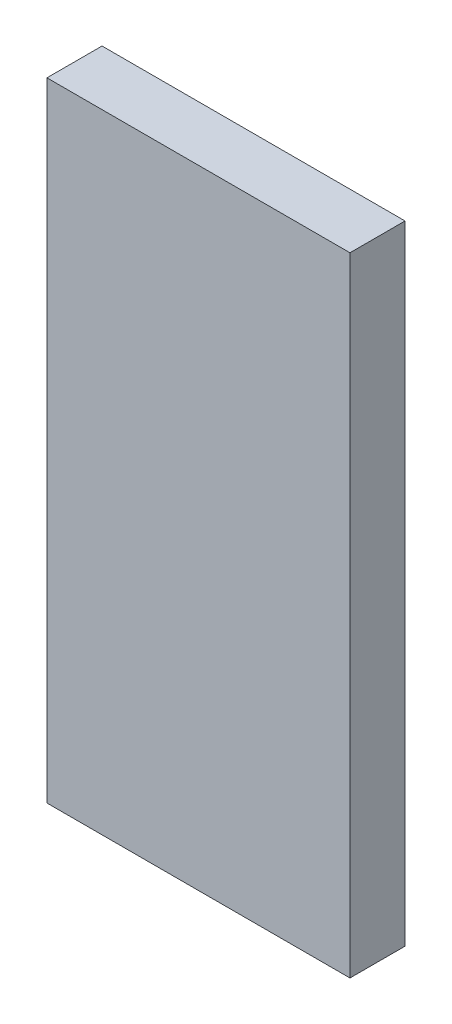
from build123d import *

# Parameters (mm, degrees)
SKETCH1_W                       = 39
SKETCH1_H                       = 155
BOSS_EXTRUDE1_DEPTH             = 2
BOSS_EXTRUDE2_DEPTH             = 38
SKETCH3_W                       = 2
SKETCH3_H                       = 2
BOSS_EXTRUDE3_DEPTH             = 38
SKETCH4_W                       = 2
SKETCH4_H                       = 2
BOSS_EXTRUDE4_DEPTH             = 151
SKETCH6_W                       = 35
SKETCH6_H                       = 2.2
CUT_EXTRUDE1_DEPTH              = 160.340045186
SKETCH7_W                       = 35
SKETCH7_H                       = 2.2
CUT_EXTRUDE2_DEPTH              = 89.490112442
SKETCH5_W                       = 31
SKETCH5_H                       = 2
BOSS_EXTRUDE5_DEPTH             = 2
BOSS_EXTRUDE6_REACH             = 91.367
SKETCH8_W                       = 2
SKETCH8_H                       = 2
BOSS_EXTRUDE6_DIRECTION_2_REACH = 91.367
SKETCH10_W                      = 2
SKETCH10_H                      = 2.2
SKETCH10_W_2                    = 2.2
SKETCH10_H_2                    = 2
BOSS_EXTRUDE8_DEPTH             = 2
SKETCH11_W                      = 2
SKETCH11_H                      = 2.2
SKETCH11_W_2                    = 2.2
SKETCH11_H_2                    = 2
BOSS_EXTRUDE9_DEPTH             = 2
FILLET2_R                       = 2.5
SKETCH14_W                      = 36.5
SKETCH14_H                      = 7.75
BOSS_EXTRUDE10_DEPTH            = 2
SKETCH13_W                      = 31
SKETCH13_H                      = 3
CUT_EXTRUDE4_DEPTH              = 2
FILLET3_R                       = 2
FILLET4_R                       = 0.5
SKETCH15_R                      = 5.1
CUT_EXTRUDE5_DEPTH              = 90.367219941
SKETCH16_R                      = 7.1
BOSS_EXTRUDE11_DEPTH            = 1
FILLET5_R                       = 0.5
FILLET7_R                       = 0.5
CUT_EXTRUDE6_DEPTH              = 6
SKETCH18_W                      = 29
SKETCH18_H                      = 3
CUT_EXTRUDE8_DEPTH              = 90.367219986
CUT_EXTRUDE11_DEPTH             = 90.367219986
CUT_EXTRUDE11_DEPTH_BACK        = 90.367219986
SKETCH20_W                      = 5
SKETCH20_H                      = 40
SKETCH21_W                      = 9
SKETCH21_H                      = 31
CUT_EXTRUDE12_DEPTH             = 89.41097217
CUT_EXTRUDE13_DEPTH             = 41.425858061
CUT_EXTRUDE13_DEPTH_BACK        = 41.425858061
SKETCH22_W                      = 11
SKETCH22_H                      = 8.2


with BuildPart() as part:
    # Sketch1 → Boss-Extrude1 (new body)
    with BuildSketch(Plane(origin=(0, 0, 0), x_dir=(1, 0, 0), z_dir=(0, 1, 0))):
        Rectangle(SKETCH1_W, SKETCH1_H)
    extrude(amount=BOSS_EXTRUDE1_DEPTH)

    # Sketch2 → Boss-Extrude2 (add)
    with BuildSketch(Plane(origin=(0, 2, 0), x_dir=(1, 0, 0), z_dir=(0, 1, 0))):
        Polygon((-17.5, -77.5), (-17.5, -75.5), (-17.5, 75.5), (17.5, 75.5), (17.5, -75.5), (17.5, -77.5), (19.5, -77.5), (19.5, 77.5), (-19.5, 77.5), (-19.5, -77.5), align=None)
    extrude(amount=BOSS_EXTRUDE2_DEPTH)

    # Sketch3 → Boss-Extrude3 (add)
    with BuildSketch(Plane(origin=(0, 2, 0), x_dir=(1, 0, 0), z_dir=(0, 1, 0))):
        with Locations((-16.5, -76.5)):
            Rectangle(SKETCH3_W, SKETCH3_H)
        with Locations((-16.5, -72.3)):
            Rectangle(SKETCH3_W, SKETCH3_H)
        with Locations((16.5, -76.5)):
            Rectangle(SKETCH3_W, SKETCH3_H)
        with Locations((16.5, -72.3)):
            Rectangle(SKETCH3_W, SKETCH3_H)
    extrude(amount=BOSS_EXTRUDE3_DEPTH)

    # Sketch4 → Boss-Extrude4 (add)
    with BuildSketch(Plane.XY.offset(-75.5)):
        with Locations((-16.5, 39)):
            Rectangle(SKETCH4_W, SKETCH4_H)
        Polygon((-15.5, 33.8), (-17.5, 31.8), (-17.5, 35.8), (-15.5, 35.8), align=None)
        Polygon((15.5, 35.8), (17.5, 35.8), (17.5, 31.8), (15.5, 33.8), align=None)
        with Locations((16.5, 39)):
            Rectangle(SKETCH4_W, SKETCH4_H)
    extrude(amount=BOSS_EXTRUDE4_DEPTH)

    # Sketch6 → Cut-Extrude1 (cut, through all)
    with BuildSketch(Plane.XY.offset(-75.5)):
        with Locations((0, 36.9)):
            Rectangle(SKETCH6_W, SKETCH6_H)
    extrude(amount=CUT_EXTRUDE1_DEPTH, mode=Mode.SUBTRACT)

    # Sketch7 → Cut-Extrude2 (cut, through all)
    with BuildSketch(Plane(origin=(0, 2, 0), x_dir=(1, 0, 0), z_dir=(0, 1, 0))):
        with Locations((0, -74.4)):
            Rectangle(SKETCH7_W, SKETCH7_H)
    extrude(amount=CUT_EXTRUDE2_DEPTH, mode=Mode.SUBTRACT)

    # Sketch5 → Boss-Extrude5 (add)
    with BuildSketch(Plane(origin=(0, 2, 0), x_dir=(1, 0, 0), z_dir=(0, 1, 0))):
        with Locations((0, -76.5)):
            Rectangle(SKETCH5_W, SKETCH5_H)
        with Locations((0, -72.3)):
            Rectangle(SKETCH5_W, SKETCH5_H)
    extrude(amount=BOSS_EXTRUDE5_DEPTH)

    # Boss-Extrude6: up to this face of the body (flat: up to its plane)
    boss_extrude6_end = Plane(part.part.faces().sort_by_distance((17.5, 16.9, -2.1))[0])
    # Sketch8 → Boss-Extrude6 (add, up to the picked face)
    with BuildSketch(Plane(origin=(0, 0, 0), x_dir=(0, 0, -1), z_dir=(1, 0, 0)), mode=Mode.PRIVATE) as boss_extrude6_sk1:
        with Locations((74.5, 39)):
            Rectangle(SKETCH8_W, SKETCH8_H)
    boss_extrude6_tool1 = split(extrude(boss_extrude6_sk1.sketch, amount=BOSS_EXTRUDE6_REACH, mode=Mode.PRIVATE), bisect_by=boss_extrude6_end, keep=Keep.BOTH, mode=Mode.PRIVATE)
    # Sketch8 → Boss-Extrude6 (add, up to the picked face)
    with BuildSketch(Plane(origin=(0, 0, 0), x_dir=(0, 0, -1), z_dir=(1, 0, 0)), mode=Mode.PRIVATE) as boss_extrude6_sk2:
        Polygon((75.5, 35.8), (73.5, 35.8), (73.5, 33.8), (75.5, 31.8), align=None)
    boss_extrude6_tool2 = split(extrude(boss_extrude6_sk2.sketch, amount=BOSS_EXTRUDE6_REACH, mode=Mode.PRIVATE), bisect_by=boss_extrude6_end, keep=Keep.BOTH, mode=Mode.PRIVATE)
    add(boss_extrude6_tool1.solids().sort_by(Axis((0, 39, -74.5), (1, 0, 0)))[0])
    add(boss_extrude6_tool2.solids().sort_by(Axis((0, 34.244444, -74.611111), (1, 0, 0)))[0])

    # Boss-Extrude6 direction 2: up to this face of the body (flat: up to its plane)
    boss_extrude6_direction_2_end = Plane(part.part.faces().sort_by_distance((-17.5, 16.9, -2.1))[0])
    # Sketch8 → Boss-Extrude6 direction 2 (add, up to the picked face)
    with BuildSketch(Plane(origin=(0, 0, 0), x_dir=(0, 0, -1), z_dir=(1, 0, 0)), mode=Mode.PRIVATE) as boss_extrude6_direction_2_sk1:
        with Locations((74.5, 39)):
            Rectangle(SKETCH8_W, SKETCH8_H)
    boss_extrude6_direction_2_tool1 = split(extrude(boss_extrude6_direction_2_sk1.sketch, amount=-BOSS_EXTRUDE6_DIRECTION_2_REACH, mode=Mode.PRIVATE), bisect_by=boss_extrude6_direction_2_end, keep=Keep.BOTH, mode=Mode.PRIVATE)
    # Sketch8 → Boss-Extrude6 direction 2 (add, up to the picked face)
    with BuildSketch(Plane(origin=(0, 0, 0), x_dir=(0, 0, -1), z_dir=(1, 0, 0)), mode=Mode.PRIVATE) as boss_extrude6_direction_2_sk2:
        Polygon((75.5, 35.8), (73.5, 35.8), (73.5, 33.8), (75.5, 31.8), align=None)
    boss_extrude6_direction_2_tool2 = split(extrude(boss_extrude6_direction_2_sk2.sketch, amount=-BOSS_EXTRUDE6_DIRECTION_2_REACH, mode=Mode.PRIVATE), bisect_by=boss_extrude6_direction_2_end, keep=Keep.BOTH, mode=Mode.PRIVATE)
    add(boss_extrude6_direction_2_tool1.solids().sort_by(Axis((0, 39, -74.5), (-1, 0, 0)))[0])
    add(boss_extrude6_direction_2_tool2.solids().sort_by(Axis((0, 34.244444, -74.611111), (-1, 0, 0)))[0])

    # Sketch10 → Boss-Extrude8 (add)
    with BuildSketch(Plane(origin=(-17.5, 0, 0), x_dir=(0, 0, -1), z_dir=(1, 0, 0))):
        with Locations((-76.5, 36.9)):
            Rectangle(SKETCH10_W, SKETCH10_H)
        with Locations((-74.4, 39)):
            Rectangle(SKETCH10_W_2, SKETCH10_H_2)
    extrude(amount=BOSS_EXTRUDE8_DEPTH)

    # Sketch11 → Boss-Extrude9 (add)
    with BuildSketch(Plane.ZY.offset(-17.5)):
        with Locations((76.5, 36.9)):
            Rectangle(SKETCH11_W, SKETCH11_H)
        with Locations((74.4, 39)):
            Rectangle(SKETCH11_W_2, SKETCH11_H_2)
    extrude(amount=BOSS_EXTRUDE9_DEPTH)

    # Fillet2
    fillet2_edges = [part.edges().sort_by_distance(p)[0] for p in [
        (-17.5, 16.9, 71.3),
        (17.5, 16.9, 71.3),
        (19.5, 20, 77.5),
        (-19.5, 20, 77.5),
        (-19.5, 20, -77.5),
        (-17.5, 16.9, -75.5),
        (17.5, 16.9, -75.5),
        (19.5, 20, -77.5),
        (19.5, 40, 0),
        (-19.5, 40, 0),
        (19.5, 0, 0),
        (-19.5, 0, 0),
        (0, 40, -77.5),
        (0, 0, 77.5),
        (0, 0, -77.5),
        (-17.5, 40, 77.5),
        (17.5, 40, 77.5),
    ]]
    fillet(fillet2_edges, radius=FILLET2_R)

    # Sketch14 → Boss-Extrude10 (add)
    with BuildSketch(Plane.XY.offset(-75.5)):
        with Locations((0, 5.125)):
            Rectangle(SKETCH14_W, SKETCH14_H)
    extrude(amount=BOSS_EXTRUDE10_DEPTH)

    # Sketch13 → Cut-Extrude4 (cut)
    with BuildSketch(Plane(origin=(0, 0, -77.5), x_dir=(-1, 0, 0), z_dir=(0, 0, -1))):
        with Locations((0, 5.5)):
            Rectangle(SKETCH13_W, SKETCH13_H)
    extrude(amount=-CUT_EXTRUDE4_DEPTH, mode=Mode.SUBTRACT)

    # Fillet3
    fillet3_edges = [part.edges().sort_by_distance(p)[0] for p in [
        (0, 9, -73.5),
    ]]
    fillet(fillet3_edges, radius=FILLET3_R - 0.0001)  # a hair under: the kernel refuses the full size

    # Fillet4
    fillet4_edges = [part.edges().sort_by_distance(p)[0] for p in [
        (15.5, 5.5, -75.5),
        (15.5, 4, -76.5),
        (0, 7, -75.5),
        (15.5, 7, -76.5),
        (-15.5, 5.5, -75.5),
        (-15.5, 7, -76.5),
        (0, 4, -75.5),
        (-15.5, 4, -76.5),
        (15.5, 5.5, -77.5),
        (0, 4, -77.5),
        (-15.5, 5.5, -77.5),
        (0, 7, -77.5),
    ]]
    fillet(fillet4_edges, radius=FILLET4_R)

    # Sketch15 → Cut-Extrude5 (cut, through all)
    with BuildSketch(Plane.XZ):
        with Locations(Location((0, 38.75, 0), (0, 0, 270))):
            Circle(SKETCH15_R)
        with Locations(Location((0, -38.75, 0), (0, 0, 270))):
            Circle(SKETCH15_R)
    extrude(amount=-CUT_EXTRUDE5_DEPTH, mode=Mode.SUBTRACT)

    # Sketch16 → Boss-Extrude11 (add)
    with BuildSketch(Plane(origin=(0, 2, 0), x_dir=(1, 0, 0), z_dir=(0, 1, 0))):
        with Locations(Location((0, 38.75, 0), (0, 0, 270))):
            Circle(SKETCH16_R)
        with Locations(Location((0, -38.75, 0), (0, 0, 270))):
            Circle(SKETCH16_R)
    extrude(amount=BOSS_EXTRUDE11_DEPTH)

    # Fillet5
    fillet5_edges = [part.edges().sort_by_distance(p)[0] for p in [
        (0, 2, -45.85),
        (0, 3, -45.85),
        (0, 2, 31.65),
        (0, 3, 31.65),
    ]]
    fillet(fillet5_edges, radius=FILLET5_R - 0.0001)  # a hair under: the kernel refuses the full size

    # Fillet7
    fillet7_edges = [part.edges().sort_by_distance(p)[0] for p in [
        (15.5, 40, 0.75),
        (0, 4, 77.5),
        (0, 40, -73.5),
        (-15.5, 40, 0.75),
        (-15.5, 20.75, 77.5),
        (-15.5, 39.267766953, 76.767766953),
        (15.5, 20.75, 77.5),
        (15.5, 39.267766953, 76.767766953),
    ]]
    fillet(fillet7_edges, radius=FILLET7_R)

    # Sketch17 → Cut-Extrude6 (cut)
    with BuildSketch(Plane.XZ):
        Polygon((-17, -77.5), (-17, 70.299999999), (-14.999999999, 71.3), (-14.999999999, 77.5), (14.999999999, 77.5), (14.999999999, 71.3), (17, 70.299999999), (17, -77.5), align=None)
    extrude(amount=-CUT_EXTRUDE6_DEPTH, mode=Mode.SUBTRACT)

    # Sketch18 → Cut-Extrude8 (cut, through all)
    with BuildSketch(Plane.XY):
        with Locations((0, 7.5)):
            Rectangle(SKETCH18_W, SKETCH18_H)
    extrude(amount=-CUT_EXTRUDE8_DEPTH, mode=Mode.SUBTRACT)

    # Sketch20 → Cut-Extrude11 (cut, two sides: drawn at the far end of the back side and taken through both)
    with BuildSketch(Plane.XY.offset(-CUT_EXTRUDE11_DEPTH_BACK)):
        Polygon((19.5, 40), (14.5, 40), (14.5, 6), (14.5, 0), (19.5, 0), align=None)
        with Locations((-17, 20)):
            Rectangle(SKETCH20_W, SKETCH20_H)
    extrude(amount=CUT_EXTRUDE11_DEPTH + CUT_EXTRUDE11_DEPTH_BACK, mode=Mode.SUBTRACT)

    # Sketch21 → Cut-Extrude12 (cut, through all)
    with BuildSketch(Plane.XY):
        with Locations((-10, 24.5)):
            Rectangle(SKETCH21_W, SKETCH21_H)
        with Locations((10, 24.5)):
            Rectangle(SKETCH21_W, SKETCH21_H)
    extrude(amount=-CUT_EXTRUDE12_DEPTH, mode=Mode.SUBTRACT)

    # Sketch22 → Cut-Extrude13 (cut, two sides: drawn at the far end of the back side and taken through both)
    with BuildSketch(Plane.XY.offset(-75.5).offset(-CUT_EXTRUDE13_DEPTH_BACK)):
        with Locations((0, 35.9)):
            Rectangle(SKETCH22_W, SKETCH22_H)
    extrude(amount=CUT_EXTRUDE13_DEPTH + CUT_EXTRUDE13_DEPTH_BACK, mode=Mode.SUBTRACT)


solid = part.part
